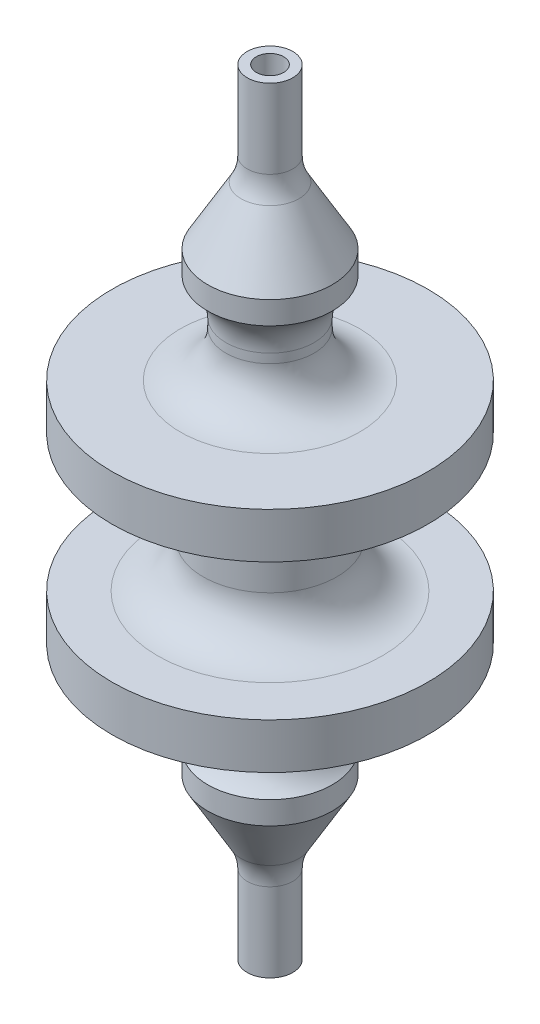
from build123d import *

# Parameters (mm, degrees)
REDONDEO1_R           = 1
CROQUIS2_R            = 0.3
CORTAR_EXTRUIR1_DEPTH = 30


with BuildPart() as part:
    # Croquis1 → Revolución1 (revolve)
    with BuildSketch(Plane.XY, mode=Mode.PRIVATE) as revoluci_n1_sk:
        Polygon((0.0820331634814839, 1.3319217282682125), (-0.4179668365185161, 1.3319217282682125), (-0.41796683651851585, -0.6680782717317876), (-1.2839922403029567, -2.1680782717317877), (-1.2839922403029567, -2.6680782717317877), (-0.8839922403029566, -2.6680782717317877), (-0.8839922403029565, -4.668078271731787), (-3.3839922403029563, -4.668078271731787), (-3.3839922403029568, -5.668078271731787), (-1.383992240302957, -5.668078271731787), (-1.383992240302957, -8.668078271731785), (-3.3839922403029568, -8.668078271731785), (-3.3839922403029563, -9.668078271731787), (-0.8839922403029565, -9.668078271731785), (-0.8839922403029566, -11.668078271731785), (-1.2839922403029567, -11.668078271731785), (-1.2839922403029567, -12.168078271731785), (-0.41796683651851585, -13.668078271731785), (-0.4179668365185161, -15.668078271731785), (0.0820331634814839, -15.668078271731785), align=None)
    revolve(revoluci_n1_sk.sketch.rotate(Axis((0.08203316348148769, -29.465929864768743, 0), (0, 1, 0)), 270), axis=Axis((0.08203316348148769, -29.465929864768743, 0), (0, 1, 0)))

    # Redondeo1
    # the kernel refuses this fillet: 1 mm, written as the material it adds along each edge
    with BuildSketch(Plane(origin=(0.08203316348148769, -9.668078271731783, 0), x_dir=(2.2e-16, 0, -1), z_dir=(1, 0, 2.2e-16))) as redondeo1_piece_1:
        with BuildLine():
            CenterArc((0.9660254037844442 + REDONDEO1_R, -REDONDEO1_R), REDONDEO1_R, 90, 89.9999999999998)
            Line((0.9660254037844442, -REDONDEO1_R), (0.9660254037844442 - REDONDEO1_R * 0.02, -REDONDEO1_R))
            Line((0.9660254037844442 - REDONDEO1_R * 0.02, -REDONDEO1_R), (0.9660254037844442 - REDONDEO1_R * 0.02, REDONDEO1_R * 0.02))
            Line((0.9660254037844442 - REDONDEO1_R * 0.02, REDONDEO1_R * 0.02), (0.9660254037844442 + REDONDEO1_R, REDONDEO1_R * 0.02))
            Line((0.9660254037844442 + REDONDEO1_R, REDONDEO1_R * 0.02), (0.9660254037844442 + REDONDEO1_R, -3.55e-15))
        make_face()
    revolve(axis=Axis((0.08203316348148769, -9.668078271731783, 0), (0, 1, 0)))
    with BuildSketch(Plane(origin=(0.08203316348148769, -11.668078271731783, 0), x_dir=(2.2e-16, 0, -1), z_dir=(1, 0, 2.2e-16))) as redondeo1_piece_2:
        with BuildLine():
            CenterArc((1.9660254037844442, 0.7999999999999989), REDONDEO1_R, 180, 53.130102354155895)
            Line((1.3660254037844437, 0), (1.3540254037844437, -0.01600000000000001))
            ThreePointArc((1.3540254037844437, -0.01600000000000001), (1.166025403784444, -0.01999999999999957), (0.9660254037844443, -0.01999999999999957))
            Line((0.9660254037844443, -0.01999999999999957), (0.9460254037844443, 0))
            Line((0.9460254037844443, 0), (0.9460254037844442, 0.7999999999999989))
            Line((0.9460254037844442, 0.7999999999999989), (0.9660254037844442, 0.7999999999999989))
        make_face()
    revolve(axis=Axis((0.08203316348148769, -11.668078271731783, 0), (0, 1, 0)))
    with BuildSketch(Plane(origin=(0.08203316348148769, -13.668078271731785, 0), x_dir=(2.2e-16, 0, -1), z_dir=(1, 0, 2.2e-16))) as redondeo1_piece_3:
        with BuildLine():
            CenterArc((0.5000000000000036 + REDONDEO1_R, -REDONDEO1_R * 0.267949192431), REDONDEO1_R, 149.99999999999991, 29.99999999999997)
            Line((0.5000000000000024, -REDONDEO1_R * 0.267949192431), (0.5000000000000036 - REDONDEO1_R * 0.02, -REDONDEO1_R * 0.267949192431))
            Line((0.5000000000000036 - REDONDEO1_R * 0.02, -REDONDEO1_R * 0.267949192431), (0.5000000000000036 - REDONDEO1_R * 0.02, REDONDEO1_R * 0.00535898384862))
            Line((0.5000000000000036 - REDONDEO1_R * 0.02, REDONDEO1_R * 0.00535898384862), (0.5000000000000036 + REDONDEO1_R * 0.11665408814, REDONDEO1_R * 0.242050807569))
            Line((0.5000000000000036 + REDONDEO1_R * 0.11665408814, REDONDEO1_R * 0.242050807569), (0.5000000000000036 + REDONDEO1_R * 0.133974596216, REDONDEO1_R * 0.232050807569))
        make_face()
    revolve(axis=Axis((0.08203316348148769, -13.668078271731785, 0), (0, 1, 0)))
    with BuildSketch(Plane(origin=(0.08203316348148769, -0.6680782717317868, 0), x_dir=(2.2e-16, 0, -1), z_dir=(1, 0, 2.2e-16))) as redondeo1_piece_4:
        with BuildLine():
            CenterArc((0.5000000000000036 + REDONDEO1_R, REDONDEO1_R * 0.267949192431), REDONDEO1_R, 180, 30.000000000000057)
            Line((0.5000000000000036 + REDONDEO1_R * 0.133974596216, -REDONDEO1_R * 0.232050807569), (0.5000000000000036 + REDONDEO1_R * 0.11665408814, -REDONDEO1_R * 0.242050807569))
            Line((0.5000000000000036 + REDONDEO1_R * 0.11665408814, -REDONDEO1_R * 0.242050807569), (0.5000000000000036 - REDONDEO1_R * 0.02, -REDONDEO1_R * 0.00535898384862))
            Line((0.5000000000000036 - REDONDEO1_R * 0.02, -REDONDEO1_R * 0.00535898384862), (0.5000000000000036 - REDONDEO1_R * 0.02, REDONDEO1_R * 0.267949192431))
            Line((0.5000000000000036 - REDONDEO1_R * 0.02, REDONDEO1_R * 0.267949192431), (0.5000000000000038, REDONDEO1_R * 0.267949192431))
        make_face()
    revolve(axis=Axis((0.08203316348148769, -0.6680782717317868, 0), (0, 1, 0)))
    with BuildSketch(Plane(origin=(0.08203316348148769, -2.668078271731787, 0), x_dir=(2.2e-16, 0, -1), z_dir=(1, 0, 2.2e-16))) as redondeo1_piece_5:
        with BuildLine():
            CenterArc((1.9660254037844442, -0.7999999999999998), REDONDEO1_R, 126.86989764584403, 53.130102354155966)
            Line((0.9660254037844442, -0.7999999999999998), (0.9460254037844442, -0.7999999999999998))
            Line((0.9460254037844442, -0.7999999999999998), (0.9460254037844443, 0))
            Line((0.9460254037844443, 0), (0.9660254037844443, 0.02000000000000002))
            ThreePointArc((0.9660254037844443, 0.02000000000000002), (1.1660254037844442, 0.02000000000000002), (1.3540254037844441, 0.01600000000000001))
            Line((1.3540254037844441, 0.01600000000000001), (1.3660254037844441, 0))
        make_face()
    revolve(axis=Axis((0.08203316348148769, -2.668078271731787, 0), (0, 1, 0)))
    with BuildSketch(Plane(origin=(0.08203316348148769, -4.668078271731787, 0), x_dir=(2.2e-16, 0, -1), z_dir=(1, 0, 2.2e-16))) as redondeo1_piece_6:
        with BuildLine():
            CenterArc((0.9660254037844442 + REDONDEO1_R, REDONDEO1_R), REDONDEO1_R, 180, 90)
            Line((0.9660254037844442 + REDONDEO1_R, 0), (0.9660254037844442 + REDONDEO1_R, -REDONDEO1_R * 0.02))
            Line((0.9660254037844442 + REDONDEO1_R, -REDONDEO1_R * 0.02), (0.9660254037844442 - REDONDEO1_R * 0.02, -REDONDEO1_R * 0.02))
            Line((0.9660254037844442 - REDONDEO1_R * 0.02, -REDONDEO1_R * 0.02), (0.9660254037844442 - REDONDEO1_R * 0.02, REDONDEO1_R))
            Line((0.9660254037844442 - REDONDEO1_R * 0.02, REDONDEO1_R), (0.9660254037844442, REDONDEO1_R))
        make_face()
    revolve(axis=Axis((0.08203316348148769, -4.668078271731787, 0), (0, 1, 0)))
    with BuildSketch(Plane(origin=(0.08203316348148769, -5.668078271731787, 0), x_dir=(2.2e-16, 0, -1), z_dir=(1, 0, 2.2e-16))) as redondeo1_piece_7:
        with BuildLine():
            CenterArc((1.4660254037844447 + REDONDEO1_R, -REDONDEO1_R), REDONDEO1_R, 90, 90)
            Line((1.4660254037844447, -REDONDEO1_R), (1.4660254037844447 - REDONDEO1_R * 0.02, -REDONDEO1_R))
            Line((1.4660254037844447 - REDONDEO1_R * 0.02, -REDONDEO1_R), (1.4660254037844447 - REDONDEO1_R * 0.02, REDONDEO1_R * 0.02))
            Line((1.4660254037844447 - REDONDEO1_R * 0.02, REDONDEO1_R * 0.02), (1.4660254037844447 + REDONDEO1_R, REDONDEO1_R * 0.02))
            Line((1.4660254037844447 + REDONDEO1_R, REDONDEO1_R * 0.02), (1.4660254037844447 + REDONDEO1_R, 0))
        make_face()
    revolve(axis=Axis((0.08203316348148769, -5.668078271731787, 0), (0, 1, 0)))
    with BuildSketch(Plane(origin=(0.08203316348148769, -8.668078271731783, 0), x_dir=(2.2e-16, 0, -1), z_dir=(1, 0, 2.2e-16))) as redondeo1_piece_8:
        with BuildLine():
            CenterArc((1.4660254037844447 + REDONDEO1_R, REDONDEO1_R), REDONDEO1_R, 180, 90)
            Line((1.4660254037844447 + REDONDEO1_R, 0), (1.4660254037844447 + REDONDEO1_R, -REDONDEO1_R * 0.02))
            Line((1.4660254037844447 + REDONDEO1_R, -REDONDEO1_R * 0.02), (1.4660254037844447 - REDONDEO1_R * 0.02, -REDONDEO1_R * 0.02))
            Line((1.4660254037844447 - REDONDEO1_R * 0.02, -REDONDEO1_R * 0.02), (1.4660254037844447 - REDONDEO1_R * 0.02, REDONDEO1_R))
            Line((1.4660254037844447 - REDONDEO1_R * 0.02, REDONDEO1_R), (1.4660254037844447, REDONDEO1_R))
        make_face()
    revolve(axis=Axis((0.08203316348148769, -8.668078271731783, 0), (0, 1, 0)))

    # Croquis2 → Cortar-Extruir1 (cut)
    with BuildSketch(Plane(origin=(0, 1.3319217282682125, 0), x_dir=(1, 0, 0), z_dir=(0, 1, 0))):
        with Locations(Location((0.08203316348148769, 0, 0), (0, 0, 270))):
            Circle(CROQUIS2_R)
    extrude(amount=-CORTAR_EXTRUIR1_DEPTH, mode=Mode.SUBTRACT)


solid = part.part
